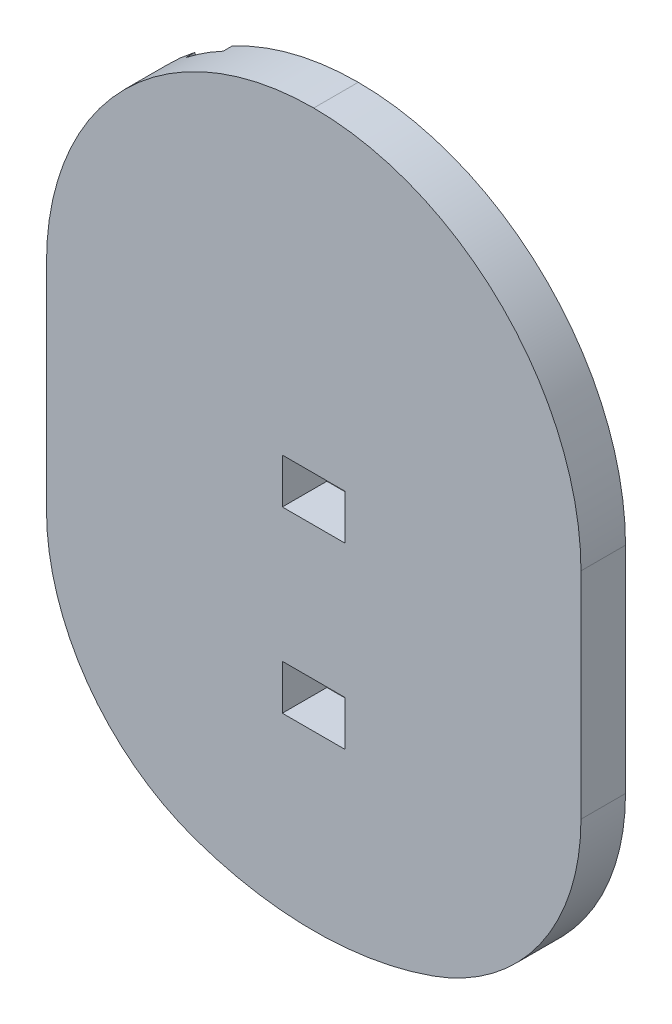
from build123d import *

# Parameters (mm, degrees)
SKETCH1_R           = 40
BOSS_EXTRUDE1_DEPTH = 5
CUT_EXTRUDE3_START  = -10
CUT_EXTRUDE3_DEPTH  = 10
FILLET1_R           = 30
FILLET2_R           = 25
SKETCH14_W          = 7.05
SKETCH14_H          = 5.05
CUT_EXTRUDE4_DEPTH  = 10
CUT_EXTRUDE5_START  = -1
CUT_EXTRUDE5_DEPTH  = 1


# Read off the part's stored shape, not the designer's step: Cut-Extrude5
with BuildPart() as part:
    # Sketch1 → Boss-Extrude1 (new body)
    with BuildSketch(Plane.XY):
        Circle(SKETCH1_R)
    extrude(amount=BOSS_EXTRUDE1_DEPTH)

    # Sketch10 → Cut-Extrude3 (cut)
    with BuildSketch(Plane.XY.offset(5).offset(CUT_EXTRUDE3_START)):
        with BuildLine():
            Line((-30, 26.457513111), (-30, -26.457513111))
            ThreePointArc((-30, -26.457513111), (-40, 0), (-30, 26.457513111))
        make_face()
        with BuildLine():
            Line((30, 26.457513111), (30, -26.457513111))
            ThreePointArc((30, -26.457513111), (40, 0), (30, 26.457513111))
        make_face()
    extrude(amount=CUT_EXTRUDE3_DEPTH, mode=Mode.SUBTRACT)

    # Fillet1
    fillet1_edges = [part.edges().sort_by_distance(p)[0] for p in [
        (-30, 26.457513111, 2.5),
        (30, 26.457513111, 2.5),
    ]]
    fillet(fillet1_edges, radius=FILLET1_R - 0.0001)  # a hair under: the kernel refuses the full size

    # Fillet2
    fillet2_edges = [part.edges().sort_by_distance(p)[0] for p in [
        (-30, -26.457513111, 2.5),
        (30, -26.457513111, 2.5),
    ]]
    fillet(fillet2_edges, radius=FILLET2_R)

    # Sketch14 → Cut-Extrude4 (cut)
    with BuildSketch(Plane.XY.offset(5)):
        with Locations((0, 1.975)):
            Rectangle(SKETCH14_W, SKETCH14_H)
        with Locations((0, -18.075)):
            Rectangle(SKETCH14_W, SKETCH14_H)
    extrude(amount=-CUT_EXTRUDE4_DEPTH, mode=Mode.SUBTRACT)

    # Cut-Extrude5 outline → Cut-Extrude5 (cut)
    with BuildSketch(Plane(origin=(0, 0, 0), x_dir=(-1, 0, 0), z_dir=(0, 0, -1)).offset(CUT_EXTRUDE5_START)):
        Polygon((15.056868042, 38), (14.160607491, 36.447631189), (9.918295379, 29.099731068), (14.248422398, 26.599731068), (18.36181188, 33.724330643), (20, 36.5617557), (20, 38), align=None)
    extrude(amount=CUT_EXTRUDE5_DEPTH, mode=Mode.SUBTRACT)


solid = part.part
